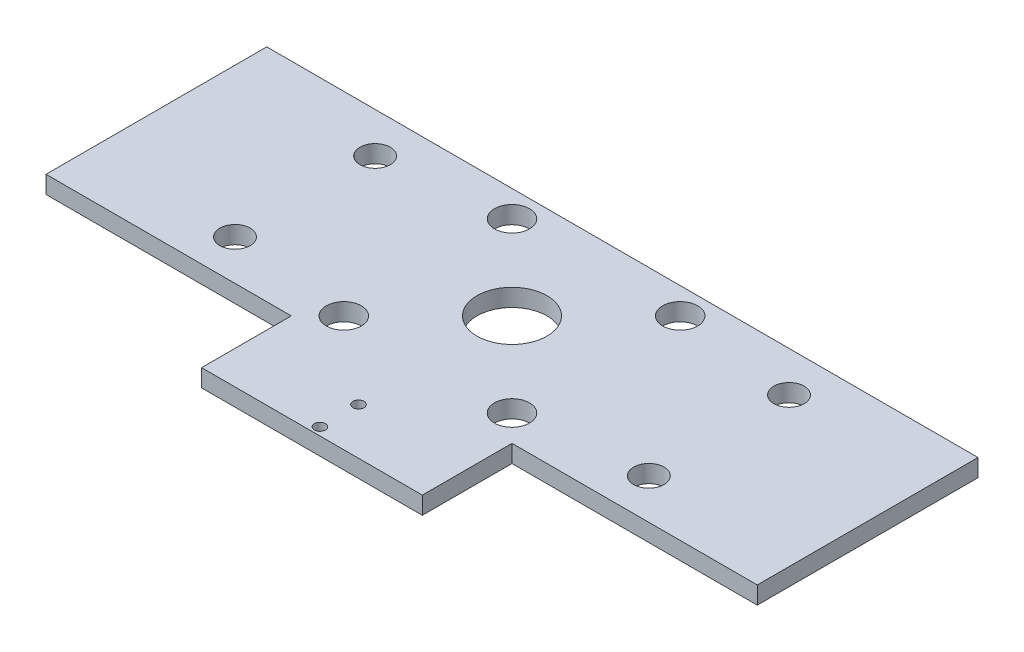
from build123d import *

# Parameters (mm, degrees)
BOSS_EXTRUDE1_DEPTH        = 3.175
F_1_1_DIAMETER_HOLE1_D     = 25.4
F_1_2_0_5_DIAMETER_HOLE1_D = 12.7
F_4_0_4_DIAMETER_HOLE1_D   = 4
M10_CLEARANCE_HOLE1_D      = 11


with BuildPart() as part:
    # Sketch1 → Boss-Extrude1 (new, symmetric)
    with BuildSketch(Plane(origin=(0, 0, 0), x_dir=(1, 0, 0), z_dir=(0, 1, 0))):
        Polygon((40, -40), (128.9, -40), (128.9, 40), (-128.9, 40), (-128.9, -40), (-40, -40), (-40, -72.5), (40, -72.5), align=None)
    extrude(amount=BOSS_EXTRUDE1_DEPTH, both=True)

    # 1 (1) Diameter Hole1 (through all)
    with Locations(Plane(origin=(0, 3.175, 0), x_dir=(1, 0, 0), z_dir=(0, 1, 0))):
        with Locations((0, 0)):
            Hole(F_1_1_DIAMETER_HOLE1_D / 2)

    # 1/2 (0.5) Diameter Hole1 (through all)
    with Locations(Plane(origin=(0, 3.175, 0), x_dir=(1, 0, 0), z_dir=(0, 1, 0))):
        with Locations((30.48, -30.48), (-30.48, 30.48), (-30.48, -30.48), (30.48, 30.48)):
            Hole(F_1_2_0_5_DIAMETER_HOLE1_D / 2)

    # Ø4.0 (4) Diameter Hole1 (through all)
    with Locations(Plane(origin=(0, 3.175, 0), x_dir=(1, 0, 0), z_dir=(0, 1, 0))):
        with Locations((0, -55.63), (0, -69.63)):
            Hole(F_4_0_4_DIAMETER_HOLE1_D / 2)

    # M10 Clearance Hole1 (through all)
    with Locations(Plane(origin=(0, 3.175, 0), x_dir=(1, 0, 0), z_dir=(0, 1, 0))):
        with Locations((75, -25.4), (-75, 25.4), (-75, -25.4), (75, 25.4)):
            Hole(M10_CLEARANCE_HOLE1_D / 2)


solid = part.part
